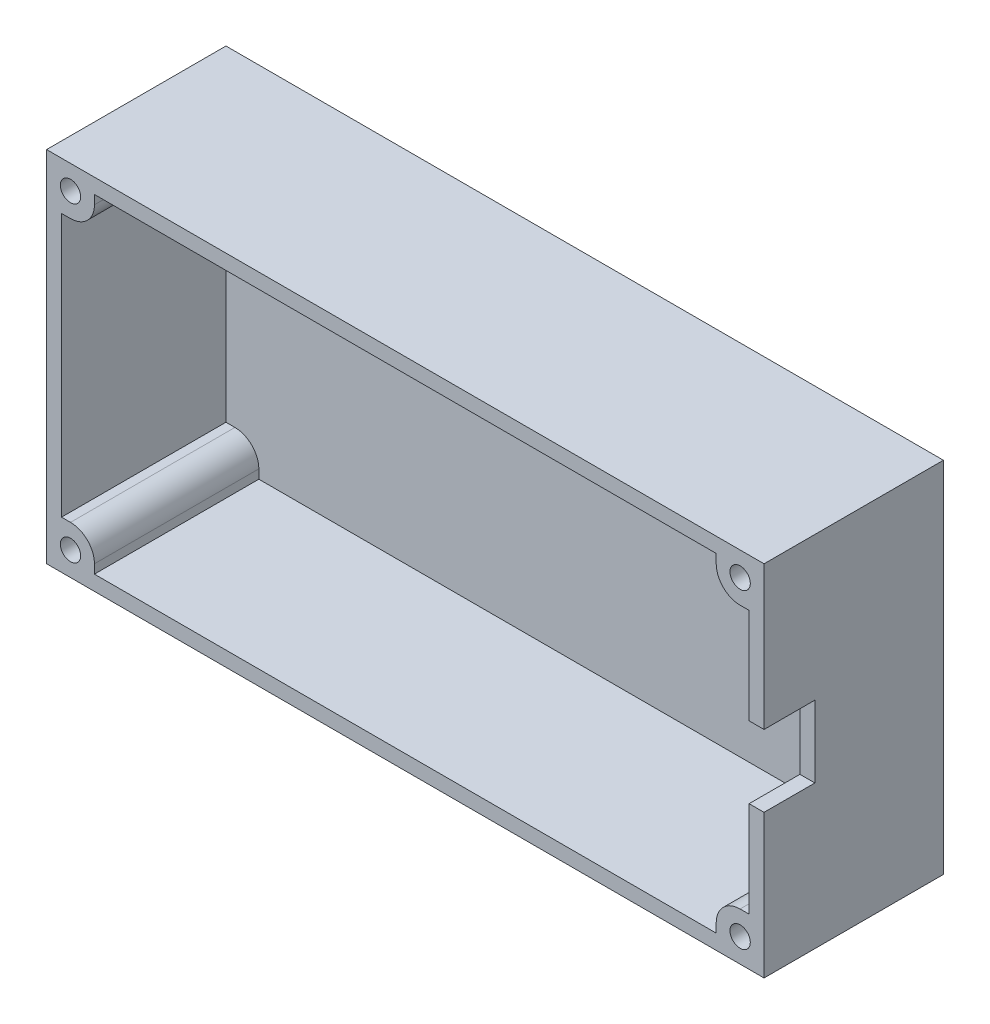
from build123d import *

# Parameters (mm, degrees)
SKETCH_1_W          = 120
SKETCH_1_H          = 60
EXTRUDE_1_DEPTH     = 2.5
SKETCH_1_3_W        = 120
SKETCH_1_3_H        = 60
EXTRUDE_2_DEPTH     = 27.5
SKETCH_2_R          = 1.7
CUT_EXTRUDE_1_DEPTH = 74.484692283
SKETCH_3_R          = 1.7
CUT_EXTRUDE_2_DEPTH = 73.5
CUT_EXTRUDE_3_DEPTH = 0.5
SKETCH_5_W          = 2.5
SKETCH_5_H          = 12
CUT_EXTRUDE_4_DEPTH = 8.5
SKETCH_6_R          = 3
CUT_EXTRUDE_5_DEPTH = 15
CHAMFER_1_SIZE      = 2


with BuildPart() as part:
    # 草图1 → 凸台-拉伸1 (new body)
    with BuildSketch(Plane.XY):
        Rectangle(SKETCH_1_W, SKETCH_1_H)
    extrude(amount=-EXTRUDE_1_DEPTH)

    # 草图1<3> → 凸台-拉伸2 (add)
    with BuildSketch(Plane.XY):
        Rectangle(SKETCH_1_3_W, SKETCH_1_3_H)
        with BuildLine():
            Line((-52, 27.5), (52, 27.5))
            Line((52, 27.5), (52, 26))
            ThreePointArc((52, 26), (53.171572875, 23.171572875), (56, 22))
            Line((56, 22), (57.5, 22))
            Line((57.5, 22), (57.5, -22))
            Line((57.5, -22), (56, -22))
            ThreePointArc((56, -22), (53.171572875, -23.171572875), (52, -26))
            Line((52, -26), (52, -27.5))
            Line((52, -27.5), (-52, -27.5))
            Line((-52, -27.5), (-52, -26))
            ThreePointArc((-52, -26), (-53.171572875, -23.171572875), (-56, -22))
            Line((-56, -22), (-57.5, -22))
            Line((-57.5, -22), (-57.5, 22))
            Line((-57.5, 22), (-56, 22))
            ThreePointArc((-56, 22), (-53.171572875, 23.171572875), (-52, 26))
            Line((-52, 26), (-52, 27.5))
        make_face(mode=Mode.SUBTRACT)
    extrude(amount=EXTRUDE_2_DEPTH)

    # 草图2 → 切除-拉伸1 (cut, through all)
    with BuildSketch(Plane.XY.offset(27.5)):
        with Locations((-56, 26)):
            Circle(SKETCH_2_R)
        with Locations((56, 26)):
            Circle(SKETCH_2_R)
        with Locations((56, -26)):
            Circle(SKETCH_2_R)
        with Locations((-56, -26)):
            Circle(SKETCH_2_R)
    extrude(amount=-CUT_EXTRUDE_1_DEPTH, mode=Mode.SUBTRACT)

    # 草图3 → 切除-拉伸2 (cut, through all)
    with BuildSketch(Plane.XY):
        with Locations((-5, 7.5)):
            Circle(SKETCH_3_R)
        with BuildLine():
            Line((52.5, 9.2), (53.5, 9.2))
            ThreePointArc((53.5, 9.2), (55.2, 7.5), (53.5, 5.8))
            Line((53.5, 5.8), (52.5, 5.8))
            ThreePointArc((52.5, 5.8), (50.8, 7.5), (52.5, 9.2))
        make_face()
        with BuildLine():
            Line((52.5, -5.8), (53.5, -5.8))
            ThreePointArc((53.5, -5.8), (55.2, -7.5), (53.5, -9.2))
            Line((53.5, -9.2), (52.5, -9.2))
            ThreePointArc((52.5, -9.2), (50.8, -7.5), (52.5, -5.8))
        make_face()
    extrude(amount=-CUT_EXTRUDE_2_DEPTH, mode=Mode.SUBTRACT)

    # 草图4 → 切除-拉伸3 (cut)
    with BuildSketch(Plane.XY):
        Polygon((-1.8, 7.5), (-3.4, 10.271281292), (-6.6, 10.271281292), (-8.2, 7.5), (-6.6, 4.728718708), (-3.4, 4.728718708), align=None)
        Polygon((56.2, 7.5), (54.6, 10.271281292), (51.4, 10.271281292), (49.8, 7.5), (51.4, 4.728718708), (54.6, 4.728718708), align=None)
        Polygon((56.2, -7.5), (54.6, -4.728718708), (51.4, -4.728718708), (49.8, -7.5), (51.4, -10.271281292), (54.6, -10.271281292), align=None)
    extrude(amount=-CUT_EXTRUDE_3_DEPTH, mode=Mode.SUBTRACT)

    # 草图5 → 切除-拉伸4 (cut)
    with BuildSketch(Plane.XY.offset(27.5)):
        with Locations((58.75, 0)):
            Rectangle(SKETCH_5_W, SKETCH_5_H)
    extrude(amount=-CUT_EXTRUDE_4_DEPTH, mode=Mode.SUBTRACT)

    # 草图6 → 切除-拉伸5 (cut)
    with BuildSketch(Plane(origin=(0, 0, -2.5), x_dir=(-1, 0, 0), z_dir=(0, 0, -1))):
        with Locations((-56, 26)):
            Circle(SKETCH_6_R)
        with Locations((-56, -26)):
            Circle(SKETCH_6_R)
        with Locations((56, -26)):
            Circle(SKETCH_6_R)
        with Locations((56, 26)):
            Circle(SKETCH_6_R)
    extrude(amount=-CUT_EXTRUDE_5_DEPTH, mode=Mode.SUBTRACT)

    # 倒角1
    # the kernel refuses this chamfer: 2 mm, written as the material it takes off along each edge
    with BuildSketch(Plane(origin=(-56, 26, 12.5), x_dir=(1, 0, 0), z_dir=(0, -1, 0))) as chamfer_1_piece_1_section:
        Polygon((1.7, CHAMFER_1_SIZE), (1.7 + CHAMFER_1_SIZE, 0), (1.7, 0), align=None)
    chamfer_1_piece_1 = revolve(axis=Axis((-56, 26, 12.5), (0, 0, 1)), mode=Mode.PRIVATE)
    chamfer_1_piece_1 = chamfer_1_piece_1 & Plane(origin=(-56, 26, 13.857190975), x_dir=(-1, 0, 0), z_dir=(0, 0, -1)) * Cylinder(3, 15, mode=Mode.PRIVATE)
    add(chamfer_1_piece_1, mode=Mode.SUBTRACT)
    with BuildSketch(Plane(origin=(-56, -26, 12.5), x_dir=(1, 0, 0), z_dir=(0, -1, 0))) as chamfer_1_piece_2_section:
        Polygon((1.7, CHAMFER_1_SIZE), (1.7 + CHAMFER_1_SIZE, 0), (1.7, 0), align=None)
    chamfer_1_piece_2 = revolve(axis=Axis((-56, -26, 12.5), (0, 0, 1)), mode=Mode.PRIVATE)
    chamfer_1_piece_2 = chamfer_1_piece_2 & Plane(origin=(-56, -26, 13.857190975), x_dir=(-1, 0, 0), z_dir=(0, 0, -1)) * Cylinder(3, 15, mode=Mode.PRIVATE)
    add(chamfer_1_piece_2, mode=Mode.SUBTRACT)
    with BuildSketch(Plane(origin=(56, -26, 12.5), x_dir=(1, 0, 0), z_dir=(0, -1, 0))) as chamfer_1_piece_3_section:
        Polygon((1.7, CHAMFER_1_SIZE), (1.7 + CHAMFER_1_SIZE, 0), (1.7, 0), align=None)
    chamfer_1_piece_3 = revolve(axis=Axis((56, -26, 12.5), (0, 0, 1)), mode=Mode.PRIVATE)
    chamfer_1_piece_3 = chamfer_1_piece_3 & Plane(origin=(56, -26, 13.857190975), x_dir=(-1, 0, 0), z_dir=(0, 0, -1)) * Cylinder(3, 15, mode=Mode.PRIVATE)
    add(chamfer_1_piece_3, mode=Mode.SUBTRACT)
    with BuildSketch(Plane(origin=(56, 26, 12.5), x_dir=(1, 0, 0), z_dir=(0, -1, 0))) as chamfer_1_piece_4_section:
        Polygon((1.7, CHAMFER_1_SIZE), (1.7 + CHAMFER_1_SIZE, 0), (1.7, 0), align=None)
    chamfer_1_piece_4 = revolve(axis=Axis((56, 26, 12.5), (0, 0, 1)), mode=Mode.PRIVATE)
    chamfer_1_piece_4 = chamfer_1_piece_4 & Plane(origin=(56, 26, 13.857190975), x_dir=(-1, 0, 0), z_dir=(0, 0, -1)) * Cylinder(3, 15, mode=Mode.PRIVATE)
    add(chamfer_1_piece_4, mode=Mode.SUBTRACT)


solid = part.part
